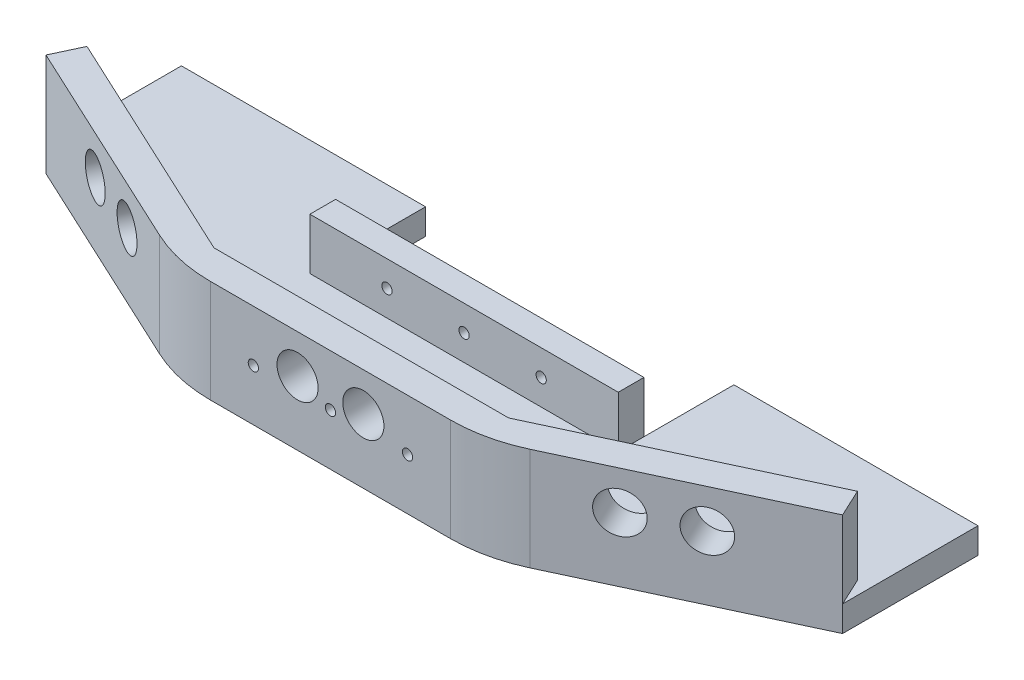
from build123d import *

# Parameters (mm, degrees)
EXTRUDE_THIN1_DEPTH = 30
SKETCH2_R           = 8
CUT_EXTRUDE1_DEPTH  = 186.661832192
SKETCH3_R           = 8
CUT_EXTRUDE2_DEPTH  = 168.240162353
BOSS_EXTRUDE1_DEPTH = 10
SKETCH7_W           = 120
SKETCH7_H           = 30
BOSS_EXTRUDE2_DEPTH = 10
SKETCH8_R           = 2
CUT_EXTRUDE3_DEPTH  = 170.614268268
FILLET1_R           = 60
SKETCH9_W           = 95
SKETCH9_H           = 52.700772475
BOSS_EXTRUDE3_DEPTH = 10
SKETCH10_W          = 11
SKETCH10_H          = 4
SKETCH10_H_2        = 5
CUT_EXTRUDE4_DEPTH  = 4.5
SKETCH13_W          = 11
SKETCH13_H          = 5
SKETCH13_H_2        = 4
CUT_EXTRUDE5_DEPTH  = 4


with BuildPart() as part:
    # Sketch1 → Extrude-Thin1 (new body)
    with BuildSketch(Plane(origin=(0, 0, 0), x_dir=(1, 0, 0), z_dir=(0, 1, 0))):
        Polygon((-155, 44.299227525), (-60, 0), (60, 0), (155, 44.299227525), (149.928580859, 55.174920969), (57.339664048, 12), (-57.339664048, 12), (-149.928580859, 55.174920969), align=None)
    extrude(amount=EXTRUDE_THIN1_DEPTH)

    # Sketch2 → Cut-Extrude1 (cut, through all)
    with BuildSketch(Plane(origin=(10.716371709, 0, 22.981333294), x_dir=(0.9063077870366495, 0, -0.4226182617407008), z_dir=(0.4226182617407008, 0, 0.9063077870366495))):
        with Locations((93.988918373, 15)):
            Circle(SKETCH2_R)
        with Locations((119.588918373, 15)):
            Circle(SKETCH2_R)
    cut_extrude1 = extrude(amount=-CUT_EXTRUDE1_DEPTH, mode=Mode.SUBTRACT)

    # Mirror1: Cut-Extrude1 across plane
    add(cut_extrude1.mirror(Plane(origin=(0, 0, 0), x_dir=(0, 0, 1), z_dir=(1, 0, 0))), mode=Mode.SUBTRACT)

    # Sketch3 → Cut-Extrude2 (cut, through all)
    with BuildSketch(Plane.XY):
        with Locations((12.8, 15)):
            Circle(SKETCH3_R)
        with Locations((-12.8, 15)):
            Circle(SKETCH3_R)
    extrude(amount=-CUT_EXTRUDE2_DEPTH, mode=Mode.SUBTRACT)

    # Sketch5 → Boss-Extrude1 (add)
    with BuildSketch(Plane.XZ):
        Polygon((66.80863999, -55.174920969), (149.928580859, -55.174920969), (155, -44.299227525), (60, 0), (-60, 0), (-155, -44.299227525), (-149.928580859, -55.174920969), (-66.80863999, -55.174920969), (-60, -52), (60, -52), align=None)
    extrude(amount=BOSS_EXTRUDE1_DEPTH)

    # Sketch7 → Boss-Extrude2 (add)
    with BuildSketch(Plane(origin=(0, 0, -52), x_dir=(-1, 0, 0), z_dir=(0, 0, -1))):
        with Locations((0, 5)):
            Rectangle(SKETCH7_W, SKETCH7_H)
    extrude(amount=BOSS_EXTRUDE2_DEPTH)

    # Sketch8 → Cut-Extrude3 (cut, through all)
    with BuildSketch(Plane(origin=(0, 0, -62), x_dir=(-1, 0, 0), z_dir=(0, 0, -1))):
        with Locations((0, 10)):
            Circle(SKETCH8_R)
        with Locations((-30, 10)):
            Circle(SKETCH8_R)
        with Locations((30, 10)):
            Circle(SKETCH8_R)
    extrude(amount=-CUT_EXTRUDE3_DEPTH, mode=Mode.SUBTRACT)

    # Fillet1
    fillet1_edges = [part.edges().sort_by_distance(p)[0] for p in [
        (-60, 10, 0),
        (60, 10, 0),
    ]]
    fillet(fillet1_edges, radius=FILLET1_R)

    # Sketch9 → Boss-Extrude3 (add)
    with BuildSketch(Plane(origin=(0, 0, 0), x_dir=(1, 0, 0), z_dir=(0, 1, 0))):
        with Locations((107.5, 70.649613762)):
            Rectangle(SKETCH9_W, SKETCH9_H)
    boss_extrude3 = extrude(amount=-BOSS_EXTRUDE3_DEPTH)

    # Mirror2: Boss-Extrude3 across plane
    add(boss_extrude3.mirror(Plane(origin=(0, 0, 0), x_dir=(0, 0, 1), z_dir=(1, 0, 0))))

    # Sketch10 → Cut-Extrude4 (cut)
    with BuildSketch(Plane(origin=(5.644952569, 0, 12.105639849), x_dir=(-0.9063077870366494, 0, 0.42261826174070083), z_dir=(-0.42261826174070083, 0, -0.9063077870366494))):
        with Locations((-106.788918373, 23.3)):
            Rectangle(SKETCH10_W, SKETCH10_H)
        with Locations((-106.788918373, 7.2)):
            Rectangle(SKETCH10_W, SKETCH10_H_2)
    cut_extrude4 = extrude(amount=-CUT_EXTRUDE4_DEPTH, mode=Mode.SUBTRACT)

    # Mirror3: Cut-Extrude4 across plane
    add(cut_extrude4.mirror(Plane(origin=(0, 0, 0), x_dir=(0, 0, 1), z_dir=(1, 0, 0))), mode=Mode.SUBTRACT)

    # Sketch13 → Cut-Extrude5 (cut)
    with BuildSketch(Plane(origin=(0, 0, -12), x_dir=(-1, 0, 0), z_dir=(0, 0, -1))):
        with Locations((0, 7.2)):
            Rectangle(SKETCH13_W, SKETCH13_H)
        with Locations((0, 23.3)):
            Rectangle(SKETCH13_W, SKETCH13_H_2)
    extrude(amount=-CUT_EXTRUDE5_DEPTH, mode=Mode.SUBTRACT)


solid = part.part
